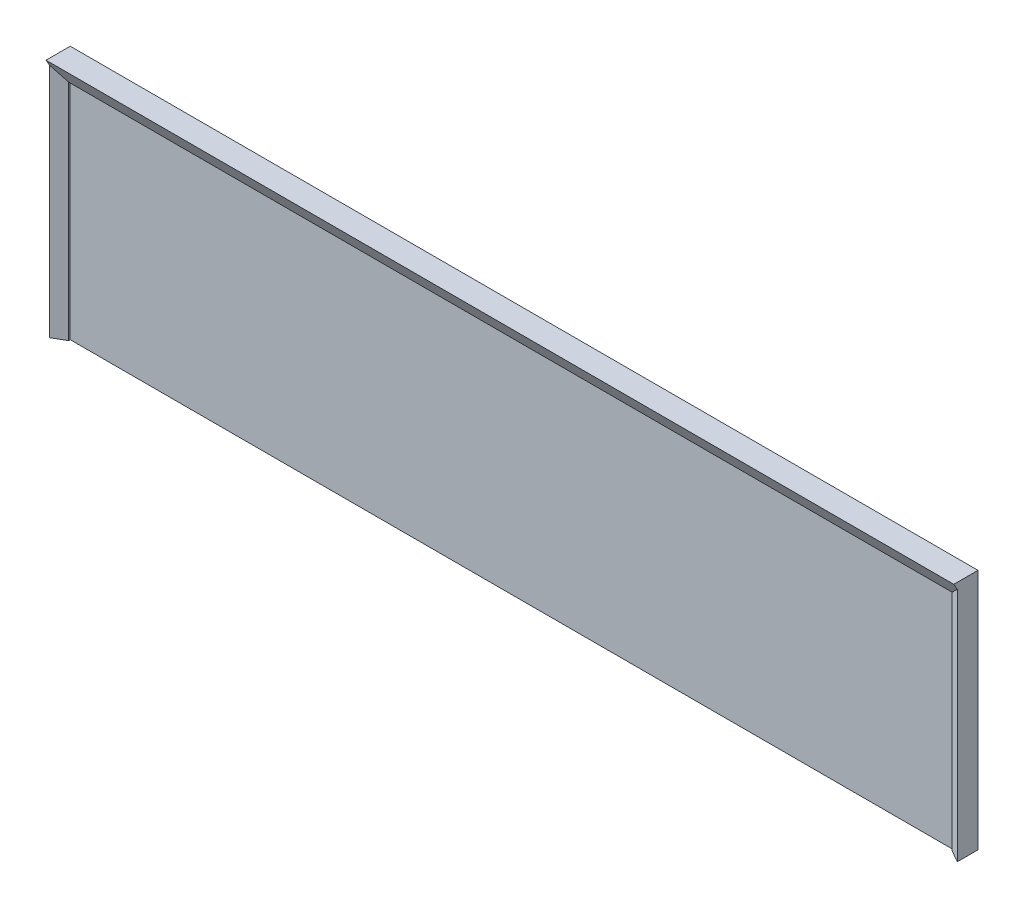
from build123d import *

# Parameters (mm, degrees)
SKETCH1_W           = 146
SKETCH1_H           = 37
BOSS_EXTRUDE1_DEPTH = 2
BOSS_EXTRUDE2_DEPTH = 4


with BuildPart() as part:
    # Sketch1 → Boss-Extrude1 (new body)
    with BuildSketch(Plane.XY):
        with Locations((75, 18.5)):
            Rectangle(SKETCH1_W, SKETCH1_H)
    extrude(amount=BOSS_EXTRUDE1_DEPTH)

    # Sketch1<4> → Boss-Extrude2 (add)
    with BuildSketch(Plane.XY):
        Polygon((2, 0), (2, 37), (148, 37), (148, 0), (150, 0), (150, 40), (0, 40), (0, 0), align=None)
    extrude(amount=BOSS_EXTRUDE2_DEPTH)

    # Chamfer1
    # the kernel refuses this chamfer: 3, 1.732050808 mm, written as the material it takes off along each edge
    with BuildSketch(Plane(origin=(148, 37, 4), x_dir=(-0.05789386240267211, 0, -0.9983227437537925), z_dir=(0, -1, 0)), Plane(origin=(2, 0, 4), x_dir=(0.05789386240267088, 0, -0.9983227437537927), z_dir=(0, 1, 0))) as chamfer1_piece_1:
        with BuildLine():
            Line((1.795061586, 0), (-0.239597459, 3.095243342))
            Line((-0.239597459, 3.095243342), (-0.299496823, 3.091769711))
            ThreePointArc((-0.299496823, 3.091769711), (-0.149748412, 1.545884855), (-0.059899365, -0.003473632))
            Line((-0.059899365, -0.003473632), (0.003473632, -0.059899365))
            ThreePointArc((0.003473632, -0.059899365), (0.897996171, -0.008024993), (1.798535218, -0.059899365))
            Line((1.798535218, -0.059899365), (1.795061586, 0))
        make_face()
    extrude(amount=37, mode=Mode.SUBTRACT)
    with BuildSketch(Plane(origin=(2, 37, 4), x_dir=(0, -0.05789386240267211, -0.9983227437537925), z_dir=(1, 0, 0))) as chamfer1_piece_2:
        with BuildLine():
            Line((1.795061586, 0), (-0.239597459, 3.095243342))
            Line((-0.239597459, 3.095243342), (-0.299496823, 3.091769711))
            ThreePointArc((-0.299496823, 3.091769711), (-0.149748412, 1.545884855), (-0.059899365, -0.003473632))
            Line((-0.059899365, -0.003473632), (0.003473632, -0.059899365))
            ThreePointArc((0.003473632, -0.059899365), (0.897996171, -0.008024993), (1.798535218, -0.059899365))
            Line((1.798535218, -0.059899365), (1.795061586, 0))
        make_face()
    extrude(amount=146, mode=Mode.SUBTRACT)
    with BuildSketch(Plane(origin=(148, 44.761257264, 4), x_dir=(-0.05789386240267211, 0, -0.9983227437537925), z_dir=(0, -1, 0))) as chamfer1_piece_3a_section:
        with BuildLine():
            Line((1.795061586, 0), (-0.239597459, 3.095243342))
            Line((-0.239597459, 3.095243342), (-0.299496823, 3.091769711))
            ThreePointArc((-0.299496823, 3.091769711), (-0.149748412, 1.545884855), (-0.059899365, -0.003473632))
            Line((-0.059899365, -0.003473632), (0.003473632, -0.059899365))
            ThreePointArc((0.003473632, -0.059899365), (0.897996171, -0.008024993), (1.798535218, -0.059899365))
            Line((1.798535218, -0.059899365), (1.795061586, 0))
        make_face()
    chamfer1_piece_3a = extrude(amount=44.761257264, mode=Mode.PRIVATE)
    chamfer1_piece_3a = split(chamfer1_piece_3a, bisect_by=Plane(origin=(149.006146815, 37, 3.444583449), z_dir=(0, 1, 0)), keep=Keep.TOP, mode=Mode.PRIVATE)
    with BuildSketch(Plane(origin=(2, 37, 4), x_dir=(0, -0.05789386240267211, -0.9983227437537925), z_dir=(1, 0, 0))) as chamfer1_piece_3b_section:
        with BuildLine():
            Line((1.795061586, 0), (-0.239597459, 3.095243342))
            Line((-0.239597459, 3.095243342), (-0.299496823, 3.091769711))
            ThreePointArc((-0.299496823, 3.091769711), (-0.149748412, 1.545884855), (-0.059899365, -0.003473632))
            Line((-0.059899365, -0.003473632), (0.003473632, -0.059899365))
            ThreePointArc((0.003473632, -0.059899365), (0.897996171, -0.008024993), (1.798535218, -0.059899365))
            Line((1.798535218, -0.059899365), (1.795061586, 0))
        make_face()
    chamfer1_piece_3b = extrude(amount=153.761257264, mode=Mode.PRIVATE)
    chamfer1_piece_3b = split(chamfer1_piece_3b, bisect_by=Plane(origin=(148, 38.006146815, 3.444583449), z_dir=(1, 0, 0)), keep=Keep.TOP, mode=Mode.PRIVATE)
    chamfer1_piece_3 = chamfer1_piece_3a & chamfer1_piece_3b
    add(chamfer1_piece_3, mode=Mode.SUBTRACT)
    with BuildSketch(Plane(origin=(-5.761257264, 37, 4), x_dir=(0, -0.05789386240267211, -0.9983227437537925), z_dir=(1, 0, 0))) as chamfer1_piece_4a_section:
        with BuildLine():
            Line((1.795061586, 0), (-0.239597459, 3.095243342))
            Line((-0.239597459, 3.095243342), (-0.299496823, 3.091769711))
            ThreePointArc((-0.299496823, 3.091769711), (-0.149748412, 1.545884855), (-0.059899365, -0.003473632))
            Line((-0.059899365, -0.003473632), (0.003473632, -0.059899365))
            ThreePointArc((0.003473632, -0.059899365), (0.897996171, -0.008024993), (1.798535218, -0.059899365))
            Line((1.798535218, -0.059899365), (1.795061586, 0))
        make_face()
    chamfer1_piece_4a = extrude(amount=153.761257264, mode=Mode.PRIVATE)
    chamfer1_piece_4a = split(chamfer1_piece_4a, bisect_by=Plane(origin=(2, 38.006146815, 3.444583449), z_dir=(-1, 0, 0)), keep=Keep.TOP, mode=Mode.PRIVATE)
    with BuildSketch(Plane(origin=(2, 0, 4), x_dir=(0.05789386240267088, 0, -0.9983227437537927), z_dir=(0, 1, 0))) as chamfer1_piece_4b_section:
        with BuildLine():
            Line((1.795061586, 0), (-0.239597459, 3.095243342))
            Line((-0.239597459, 3.095243342), (-0.299496823, 3.091769711))
            ThreePointArc((-0.299496823, 3.091769711), (-0.149748412, 1.545884855), (-0.059899365, -0.003473632))
            Line((-0.059899365, -0.003473632), (0.003473632, -0.059899365))
            ThreePointArc((0.003473632, -0.059899365), (0.897996171, -0.008024993), (1.798535218, -0.059899365))
            Line((1.798535218, -0.059899365), (1.795061586, 0))
        make_face()
    chamfer1_piece_4b = extrude(amount=44.761257264, mode=Mode.PRIVATE)
    chamfer1_piece_4b = split(chamfer1_piece_4b, bisect_by=Plane(origin=(0.993853185, 37, 3.444583449), z_dir=(0, 1, 0)), keep=Keep.TOP, mode=Mode.PRIVATE)
    chamfer1_piece_4 = chamfer1_piece_4a & chamfer1_piece_4b
    add(chamfer1_piece_4, mode=Mode.SUBTRACT)


solid = part.part
